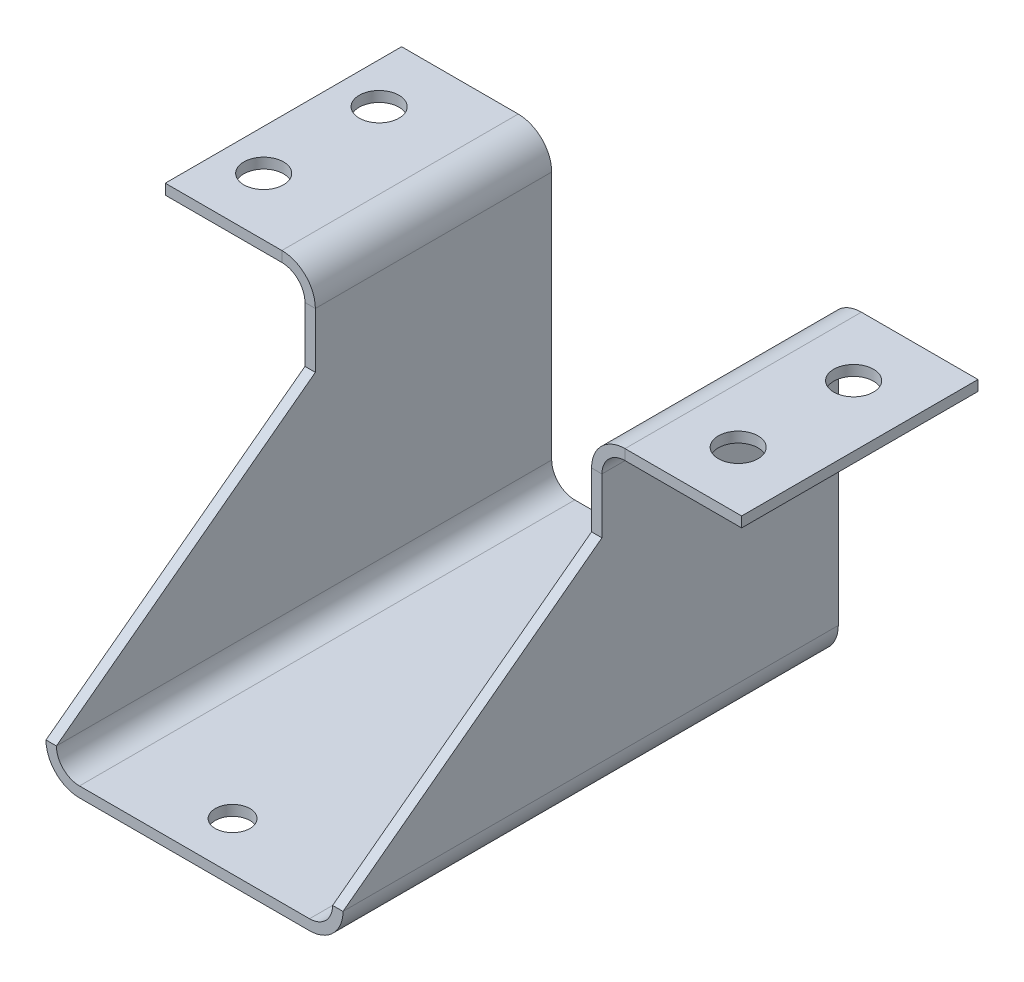
from build123d import *

# Parameters (mm, degrees)
SKETCH2_W                      = 65.3415
SKETCH2_H                      = 177.8
BASE_FLANGE1_DEPTH             = 2.286
EDGE_FLANGE1_STRIP_W           = 19.304
EDGE_FLANGE1_STRIP_H           = 2.286
EDGE_FLANGE1_STRIP_CUT_DEPTH   = 177.8
EDGE_FLANGE1_STRIP_2_W         = 19.304
EDGE_FLANGE1_STRIP_2_H         = 2.286
EDGE_FLANGE1_STRIP_CUT_2_DEPTH = 177.8
EDGE_FLANGE1_DEPTH             = 177.8
EDGE_FLANGE1_BEND_DEPTH        = 177.8
CUT_EXTRUDE1_DEPTH             = 171.223828311
CUT_EXTRUDE1_DEPTH_BACK        = 171.223828311
CUT_EXTRUDE2_DEPTH             = 171.223828311
CUT_EXTRUDE2_DEPTH_BACK        = 171.223828311
SKETCH20_W                     = 141.560534952
SKETCH20_H                     = 182.926434851
EDGE_FLANGE3_STRIP_W           = 19.304
EDGE_FLANGE3_STRIP_H           = 2.286
EDGE_FLANGE3_STRIP_CUT_DEPTH   = 52
EDGE_FLANGE3_STRIP_2_W         = 19.304
EDGE_FLANGE3_STRIP_2_H         = 2.286
EDGE_FLANGE3_STRIP_CUT_2_DEPTH = 52
EDGE_FLANGE3_DEPTH             = 52
EDGE_FLANGE3_BEND_DEPTH        = 52
SKETCH30_R                     = 3.81
CUT_EXTRUDE3_DEPTH             = 129.336350021
SKETCH31_R                     = 4.3688
CUT_EXTRUDE4_DEPTH             = 129.336350021


# Sheet-metal steps are written as plain solids
with BuildPart() as part:
    # Sketch2 → Base-Flange1 (new body)
    with BuildSketch(Plane(origin=(0, 0, 0), x_dir=(1, 0, 0), z_dir=(0, 1, 0))):
        with Locations((2.25425, 63.5)):
            Rectangle(SKETCH2_W, SKETCH2_H)
    extrude(amount=-BASE_FLANGE1_DEPTH)

    # Edge-Flange1 strip (across the edge) → Edge-Flange1 strip cut (cut)
    with BuildSketch(Plane(origin=(-30.4165, 0, -152.4), x_dir=(1, 0, 0), z_dir=(0, 0, 1))):
        with Locations((-2.286, -1.143)):
            Rectangle(EDGE_FLANGE1_STRIP_W, EDGE_FLANGE1_STRIP_H)
    extrude(amount=EDGE_FLANGE1_STRIP_CUT_DEPTH, mode=Mode.SUBTRACT)

    # Edge-Flange1 strip 2 (across the edge) → Edge-Flange1 strip cut 2 (cut)
    with BuildSketch(Plane(origin=(34.925, 0, 25.4), x_dir=(-1, 0, 0), z_dir=(0, 0, -1))):
        with Locations((-2.286, -1.143)):
            Rectangle(EDGE_FLANGE1_STRIP_2_W, EDGE_FLANGE1_STRIP_2_H)
    extrude(amount=EDGE_FLANGE1_STRIP_CUT_2_DEPTH, mode=Mode.SUBTRACT)

    # Edge-Flange1 section (across the edge) → Edge-Flange1 (add)
    with BuildSketch(Plane(origin=(-30.4165, 0, -152.4), x_dir=(1, 0, 0), z_dir=(0, 0, 1))):
        with BuildLine():
            Line((0, 5.08), (0, 67.31))
            Line((0, 67.31), (2.286, 67.31))
            Line((2.286, 67.31), (2.286, 5.08))
            ThreePointArc((2.286, 5.08), (3.773897552, 1.487897552), (7.366, 0))
            Line((7.366, 0), (7.366, -2.286))
            ThreePointArc((7.366, -2.286), (2.15745145, -0.12854855), (0, 5.08))
        make_face()
    extrude(amount=EDGE_FLANGE1_DEPTH)

    # Edge-Flange1 section 2 (across the edge) → Edge-Flange1 bend (add)
    with BuildSketch(Plane(origin=(34.925, 0, 25.4), x_dir=(-1, 0, 0), z_dir=(0, 0, -1))):
        with BuildLine():
            Line((0, 5.08), (0, 67.31))
            Line((0, 67.31), (2.286, 67.31))
            Line((2.286, 67.31), (2.286, 5.08))
            ThreePointArc((2.286, 5.08), (3.773897552, 1.487897552), (7.366, 0))
            Line((7.366, 0), (7.366, -2.286))
            ThreePointArc((7.366, -2.286), (2.15745145, -0.12854855), (0, 5.08))
        make_face()
    extrude(amount=EDGE_FLANGE1_BEND_DEPTH)

    # Sketch19 → Cut-Extrude1 (cut, two sides: drawn at the far end of the back side and taken through both)
    with BuildSketch(Plane(origin=(0, 0, 0), x_dir=(0, 0, -1), z_dir=(1, 0, 0)).offset(-CUT_EXTRUDE1_DEPTH_BACK)):
        Polygon((-21.631039281, 5.08), (-21.631039281, -27.285513127), (-49.571039281, -27.285513127), (-49.571039281, 149.369143464), (35.341160719, 149.369143464), (35.341160719, 47.769143464), align=None)
    extrude(amount=CUT_EXTRUDE1_DEPTH + CUT_EXTRUDE1_DEPTH_BACK, mode=Mode.SUBTRACT)

    # Sketch20 → Cut-Extrude2 (cut, two sides: drawn at the far end of the back side and taken through both)
    with BuildSketch(Plane(origin=(0, 0, 0), x_dir=(0, 0, -1), z_dir=(1, 0, 0)).offset(-CUT_EXTRUDE2_DEPTH_BACK)):
        with Locations((158.121428195, 37.56832172)):
            Rectangle(SKETCH20_W, SKETCH20_H)
    extrude(amount=CUT_EXTRUDE2_DEPTH + CUT_EXTRUDE2_DEPTH_BACK, mode=Mode.SUBTRACT)

    # Edge-Flange3 strip (across the edge) → Edge-Flange3 strip cut (cut)
    with BuildSketch(Plane(origin=(-30.4165, 67.31, -35.341160719), x_dir=(0, -1, 0), z_dir=(0, 0, -1))):
        with Locations((-2.286, -1.143)):
            Rectangle(EDGE_FLANGE3_STRIP_W, EDGE_FLANGE3_STRIP_H)
    extrude(amount=EDGE_FLANGE3_STRIP_CUT_DEPTH, mode=Mode.SUBTRACT)

    # Edge-Flange3 strip 2 (across the edge) → Edge-Flange3 strip cut 2 (cut)
    with BuildSketch(Plane(origin=(34.925, 67.31, -87.341160719), x_dir=(0, -1, 0), z_dir=(0, 0, 1))):
        with Locations((-2.286, -1.143)):
            Rectangle(EDGE_FLANGE3_STRIP_2_W, EDGE_FLANGE3_STRIP_2_H)
    extrude(amount=EDGE_FLANGE3_STRIP_CUT_2_DEPTH, mode=Mode.SUBTRACT)

    # Edge-Flange3 section (across the edge) → Edge-Flange3 (add)
    with BuildSketch(Plane(origin=(-30.4165, 67.31, -35.341160719), x_dir=(0, -1, 0), z_dir=(0, 0, -1))):
        with BuildLine():
            Line((0, 5.08), (0, 30.734))
            Line((0, 30.734), (2.286, 30.734))
            Line((2.286, 30.734), (2.286, 5.08))
            ThreePointArc((2.286, 5.08), (3.773897552, 1.487897552), (7.366, 0))
            Line((7.366, 0), (7.366, -2.286))
            ThreePointArc((7.366, -2.286), (2.15745145, -0.12854855), (0, 5.08))
        make_face()
    extrude(amount=EDGE_FLANGE3_DEPTH)

    # Edge-Flange3 section 2 (across the edge) → Edge-Flange3 bend (add)
    with BuildSketch(Plane(origin=(34.925, 67.31, -87.341160719), x_dir=(0, -1, 0), z_dir=(0, 0, 1))):
        with BuildLine():
            Line((0, 5.08), (0, 30.734))
            Line((0, 30.734), (2.286, 30.734))
            Line((2.286, 30.734), (2.286, 5.08))
            ThreePointArc((2.286, 5.08), (3.773897552, 1.487897552), (7.366, 0))
            Line((7.366, 0), (7.366, -2.286))
            ThreePointArc((7.366, -2.286), (2.15745145, -0.12854855), (0, 5.08))
        make_face()
    extrude(amount=EDGE_FLANGE3_BEND_DEPTH)

    # Sketch30 → Cut-Extrude3 (cut, through all)
    with BuildSketch(Plane(origin=(0, 0, 0), x_dir=(1, 0, 0), z_dir=(0, 1, 0))):
        with Locations(Location((0, -10.995792601, 0), (0, 0, 270))):
            Circle(SKETCH30_R)
        with Locations(Location((0, 65.204207399, 0), (0, 0, 270))):
            Circle(SKETCH30_R)
    extrude(amount=-CUT_EXTRUDE3_DEPTH, mode=Mode.SUBTRACT)

    # Sketch31 → Cut-Extrude4 (cut, symmetric)
    with BuildSketch(Plane(origin=(0, 0, 0), x_dir=(1, 0, 0), z_dir=(0, 1, 0))):
        with Locations(Location((52.197, 73.441160719, 0), (0, 0, 270))):
            Circle(SKETCH31_R)
        with Locations(Location((52.197, 48.041160719, 0), (0, 0, 270))):
            Circle(SKETCH31_R)
    cut_extrude4 = extrude(amount=CUT_EXTRUDE4_DEPTH, both=True, mode=Mode.SUBTRACT)

    # Mirror1: Cut-Extrude4 across plane
    add(cut_extrude4.mirror(Plane(origin=(0, 0, 0), x_dir=(0, 0, 1), z_dir=(1, 0, 0))), mode=Mode.SUBTRACT)


solid = part.part
